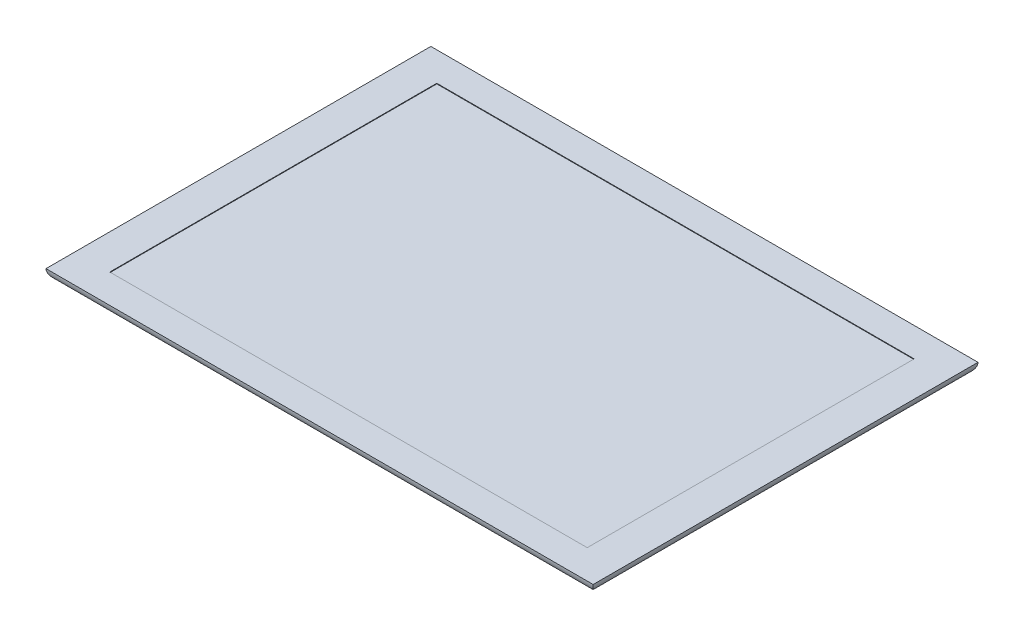
from build123d import *

# Parameters (mm, degrees)
SKETCH1_W           = 374.65
SKETCH1_H           = 263.525
SKETCH1_W_2         = 326.91662515
SKETCH1_H_2         = 223.901
BOSS_EXTRUDE1_DEPTH = 7.5
SKETCH1_2_W         = 326.91662515
SKETCH1_2_H         = 223.901
BOSS_EXTRUDE2_DEPTH = 7.1
FILLET1_R           = 7.62
FILLET2_R           = 7.62


with BuildPart() as part:
    # Sketch1 → Boss-Extrude1 (new body)
    with BuildSketch(Plane(origin=(0, 0, 0), x_dir=(1, 0, 0), z_dir=(0, 1, 0))):
        Rectangle(SKETCH1_W, SKETCH1_H)
        Rectangle(SKETCH1_W_2, SKETCH1_H_2, mode=Mode.SUBTRACT)
    extrude(amount=BOSS_EXTRUDE1_DEPTH)

    # Sketch1<2> → Boss-Extrude2 (add)
    with BuildSketch(Plane(origin=(0, 0, 0), x_dir=(1, 0, 0), z_dir=(0, 1, 0))):
        Rectangle(SKETCH1_2_W, SKETCH1_2_H)
    extrude(amount=BOSS_EXTRUDE2_DEPTH)

    # Fillet1
    # the kernel refuses this fillet: 7.62 mm, written as the material it takes off along each edge
    with BuildSketch(Plane(origin=(206.375, 0, -131.7625), x_dir=(0, 0, 1), z_dir=(-1, 0, 0))) as fillet1_piece_1:
        with BuildLine():
            CenterArc((FILLET1_R, FILLET1_R), FILLET1_R, 180, 90)
            Line((0, FILLET1_R), (0, 0))
            Line((0, 0), (FILLET1_R, 0))
        make_face()
    extrude(amount=412.75, mode=Mode.SUBTRACT)

    # Fillet2
    # the kernel refuses this fillet: 7.62 mm, written as the material it takes off along each edge
    with BuildSketch(Plane(origin=(-187.325, 0, -143.190137649), x_dir=(0, 1, 0), z_dir=(0, 0, 1)), Plane(origin=(187.325, 0, 150.810137649), x_dir=(0, 1, 0), z_dir=(0, 0, -1))) as fillet2_piece_1:
        with BuildLine():
            CenterArc((7.62, -7.61905506), FILLET2_R, 90.902333039, 89.097666961)
            Line((0, -7.61905506), (-0.1524, -7.61905506))
            Line((-0.1524, -7.61905506), (-0.1524, 0))
            Line((-0.1524, 0), (0, 0.1524))
            ThreePointArc((0, 0.1524), (3.75, 0.1524), (7.4976, 0.152381101))
            Line((7.4976, 0.152381101), (7.5, 0))
        make_face()
    extrude(amount=294.000275298, mode=Mode.SUBTRACT)
    with BuildSketch(Plane(origin=(-206.372637649, 0, 131.7625), x_dir=(0, 1, 0), z_dir=(1, 0, 0))) as fillet2_piece_2:
        with BuildLine():
            CenterArc((7.62, -7.61905506), FILLET2_R, 90.902333039, 89.097666961)
            Line((0, -7.61905506), (-0.1524, -7.61905506))
            Line((-0.1524, -7.61905506), (-0.1524, 0))
            Line((-0.1524, 0), (0, 0.1524))
            ThreePointArc((0, 0.1524), (3.75, 0.1524), (7.4976, 0.152381101))
            Line((7.4976, 0.152381101), (7.5, 0))
        make_face()
    extrude(amount=412.745275298, mode=Mode.SUBTRACT)


solid = part.part
